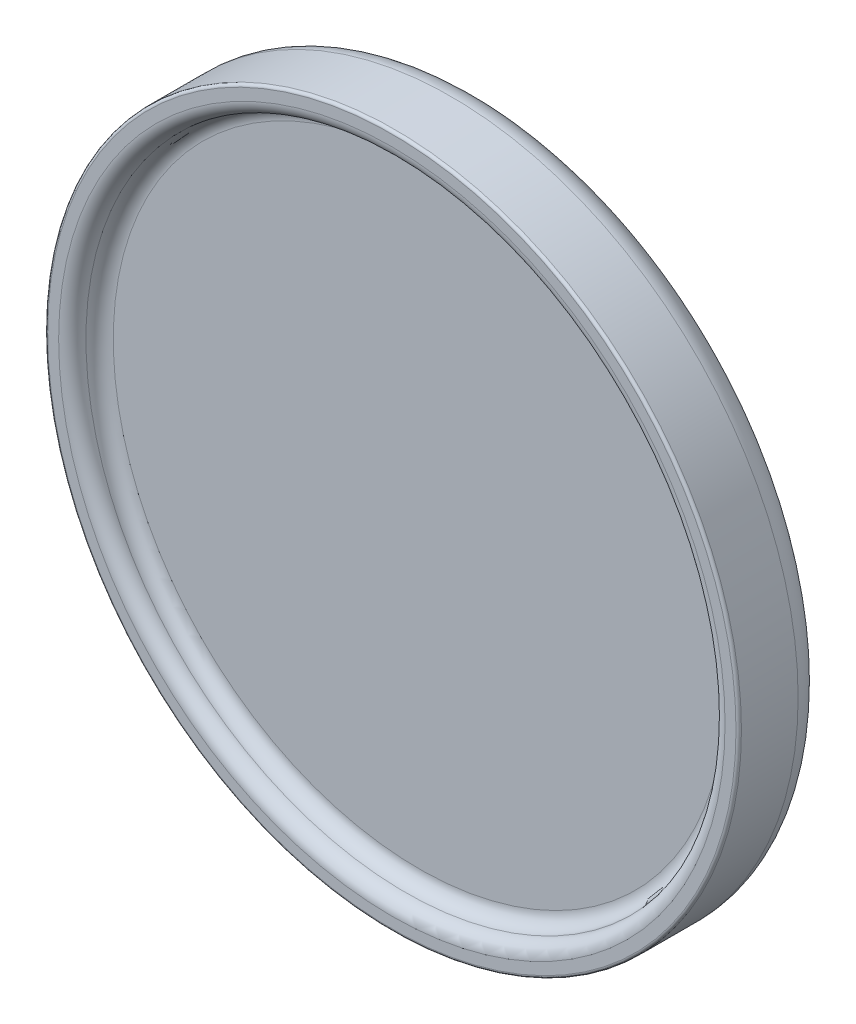
from build123d import *

# Parameters (mm, degrees)
SKETCH1_R          = 127
BASE_EXTRUDE_DEPTH = 31.75
SKETCH3_R          = 117
CUT_EXTRUDE1_DEPTH = 10
FILLET1_R          = 5
FILLET2_R          = 5
FILLET3_R          = 1
FILLET4_R          = 10
SCALE2_SCALE       = 1.2


with BuildPart() as part:
    # Sketch1 → Base-Extrude (new body)
    with BuildSketch(Plane.XY):
        Circle(SKETCH1_R)
    extrude(amount=-BASE_EXTRUDE_DEPTH)

    # Sketch3 → Cut-Extrude1 (cut)
    with BuildSketch(Plane.XY):
        Circle(SKETCH3_R)
    extrude(amount=-CUT_EXTRUDE1_DEPTH, mode=Mode.SUBTRACT)

    # Fillet1
    fillet1_edges = [part.edges().sort_by_distance(p)[0] for p in [
        (-117, 0, 0),
    ]]
    fillet(fillet1_edges, radius=FILLET1_R)

    # Fillet2
    fillet2_edges = [part.edges().sort_by_distance(p)[0] for p in [
        (-117, 0, -10),
    ]]
    fillet(fillet2_edges, radius=FILLET2_R - 0.0001)  # a hair under: the kernel refuses the full size

    # Fillet3
    fillet3_edges = [part.edges().sort_by_distance(p)[0] for p in [
        (-127, 0, 0),
    ]]
    fillet(fillet3_edges, radius=FILLET3_R)

    # Fillet4
    fillet4_edges = [part.edges().sort_by_distance(p)[0] for p in [
        (-127, 0, -31.75),
    ]]
    fillet(fillet4_edges, radius=FILLET4_R)


with BuildPart() as part_1:
    # Scale2: scaled about (0, 0, -19.732997693)
    add(part.part.scale(SCALE2_SCALE).moved(Location((0, 0, 3.946599539))))


solid = part_1.part
